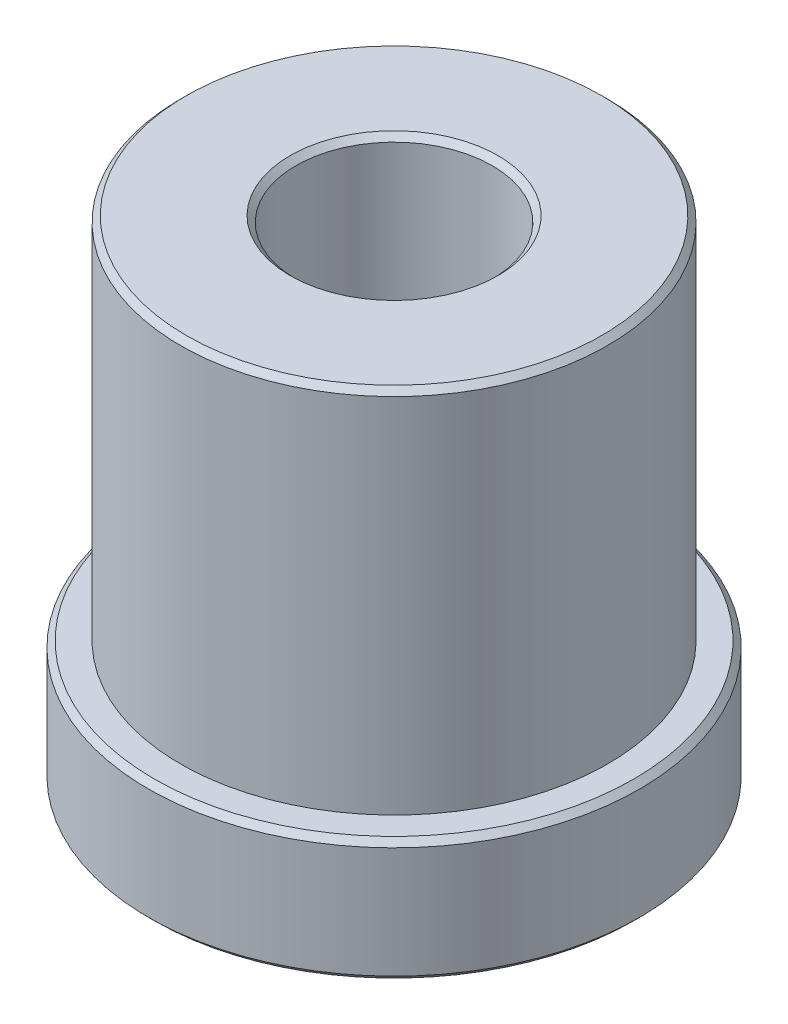
from build123d import *

# Parameters (mm, degrees)
SKETCH1_R           = 11.049
BOSS_EXTRUDE1_DEPTH = 19.05
SKETCH2_R           = 12.7
BOSS_EXTRUDE2_DEPTH = 6.35
SKETCH3_R           = 5.08
CUT_EXTRUDE1_DEPTH  = 32.108519733
SKETCH4_R           = 11.1125
CUT_EXTRUDE2_DEPTH  = 5.5372
CHAMFER1_SIZE       = 0.299999908


with BuildPart() as part:
    # Sketch1 → Boss-Extrude1 (new body)
    with BuildSketch(Plane(origin=(0, 0, 0), x_dir=(1, 0, 0), z_dir=(0, 1, 0))):
        Circle(SKETCH1_R)
    extrude(amount=BOSS_EXTRUDE1_DEPTH)

    # Sketch2 → Boss-Extrude2 (add)
    with BuildSketch(Plane.XZ):
        Circle(SKETCH2_R)
    extrude(amount=BOSS_EXTRUDE2_DEPTH)

    # Sketch3 → Cut-Extrude1 (cut, through all)
    with BuildSketch(Plane.XZ.offset(6.35)):
        Circle(SKETCH3_R)
    extrude(amount=-CUT_EXTRUDE1_DEPTH, mode=Mode.SUBTRACT)

    # Sketch4 → Cut-Extrude2 (cut)
    with BuildSketch(Plane.XZ.offset(6.35)):
        Circle(SKETCH4_R)
    extrude(amount=-CUT_EXTRUDE2_DEPTH, mode=Mode.SUBTRACT)

    # Chamfer1
    chamfer1_edges = [part.edges().sort_by_distance(p)[0] for p in [
        (-5.08, -0.8128, 0),
        (-12.7, 0, 0),
        (-12.7, -6.35, 0),
        (-11.1125, -6.35, 0),
        (-11.049, 19.05, 0),
        (-5.08, 19.05, 0),
    ]]
    chamfer(chamfer1_edges, length=CHAMFER1_SIZE)


solid = part.part
